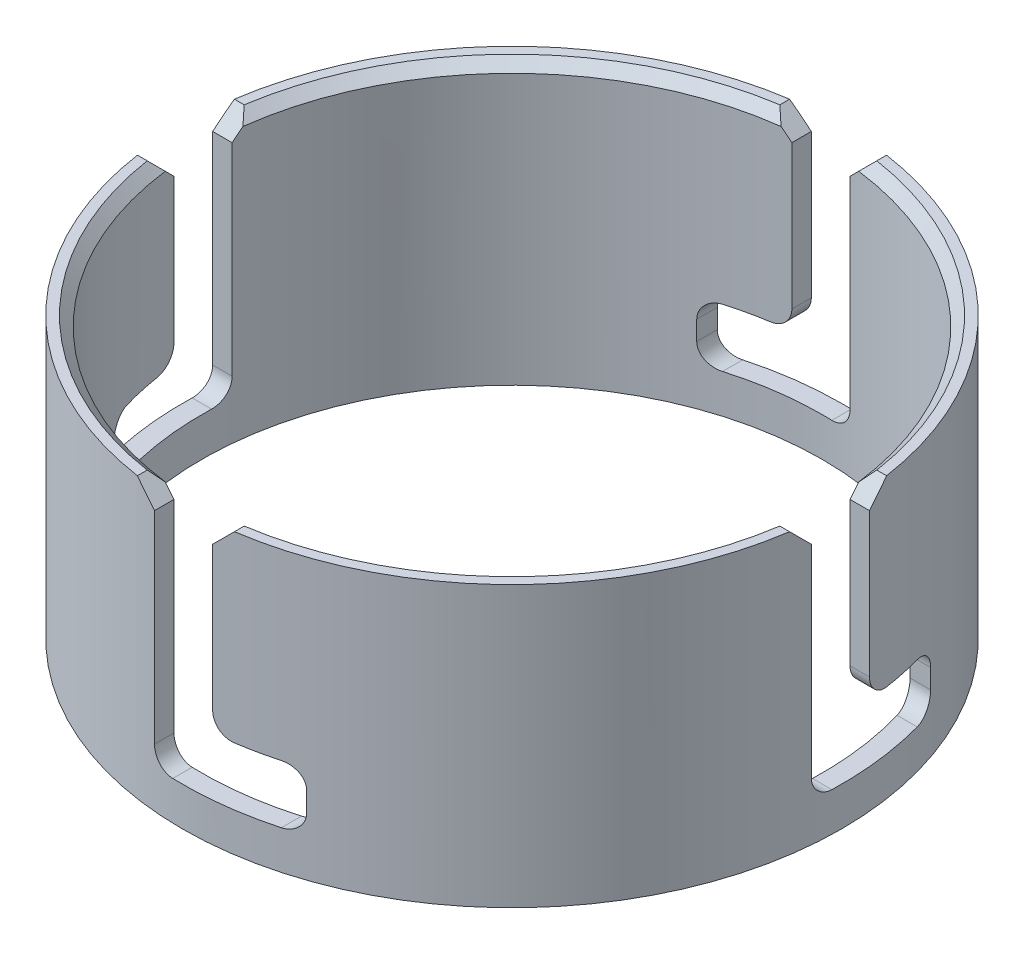
from build123d import *

# Parameters (mm, degrees)
SKETCH2_W                    = 5
SKETCH2_H                    = 72.15
CUT_EXTRUDE1_DEPTH           = 141.198304911
FILLET1_R                    = 5
CHAMFER1_SIZE                = 5
FILLET3_R                    = 5
CIRPATTERN1_COUNT            = 4
FILLET1_OF_CIRPATTERN1_R     = 5
CHAMFER1_OF_CIRPATTERN1_SIZE = 5
FILLET3_OF_CIRPATTERN1_R     = 5
CHAMFER2_SIZE                = 2.5


with BuildPart() as part:
    # Sketch2 → Revolve1 (revolve)
    with BuildSketch(Plane(origin=(0, 0, 0), x_dir=(0, 0, -1), z_dir=(1, 0, 0))):
        with Locations((-82.49983, 36.075)):
            Rectangle(SKETCH2_W, SKETCH2_H)
    revolve(axis=Axis((0, -0.75, 0), (0, 1, 0)))

    # Sketch3 → Cut-Extrude1 (cut, through all)
    with BuildSketch(Plane(origin=(0, 0, 0), x_dir=(0, 0, -1), z_dir=(1, 0, 0))):
        Polygon((-7.5, 72.15), (7.5, 72.15), (7.5, 10), (-27.5, 10), (-27.5, 25), (-7.5, 25), align=None)
    cut_extrude1 = extrude(amount=-CUT_EXTRUDE1_DEPTH, mode=Mode.SUBTRACT)

    # Fillet1
    fillet1_edges = [part.edges().sort_by_distance(p)[0] for p in [
        (-82.157895651, 25, 7.5),
        (-82.157895651, 10, -7.5),
    ]]
    fillet(fillet1_edges, radius=FILLET1_R)

    # Chamfer1
    chamfer1_edges = [part.edges().sort_by_distance(p)[0] for p in [
        (-82.157895651, 72.15, 7.5),
        (-82.157895651, 72.15, -7.5),
    ]]
    chamfer(chamfer1_edges, length=CHAMFER1_SIZE)

    # Fillet3
    fillet3_edges = [part.edges().sort_by_distance(p)[0] for p in [
        (-77.776537511, 25, 27.5),
        (-77.776537511, 10, 27.5),
    ]]
    fillet(fillet3_edges, radius=FILLET3_R)

    # CirPattern1: Cut-Extrude1 ×4 about axis
    cirpattern1_axis = Axis((0, -0.75, 0), (0, 1, 0))
    for i in range(1, CIRPATTERN1_COUNT):
        add(cut_extrude1.rotate(cirpattern1_axis, i * 360 / CIRPATTERN1_COUNT), mode=Mode.SUBTRACT)

    # Fillet1 of CirPattern1
    fillet1_of_cirpattern1_edges = [part.edges().sort_by_distance(p)[0] for p in [
        (7.5, 25, 82.157895651),
        (-7.5, 10, 82.157895651),
        (82.157895651, 25, -7.5),
        (82.157895651, 10, 7.5),
        (-7.5, 25, -82.157895651),
        (7.5, 10, -82.157895651),
    ]]
    fillet(fillet1_of_cirpattern1_edges, radius=FILLET1_OF_CIRPATTERN1_R)

    # Chamfer1 of CirPattern1
    chamfer1_of_cirpattern1_edges = [part.edges().sort_by_distance(p)[0] for p in [
        (7.5, 72.15, 82.157895651),
        (-7.5, 72.15, 82.157895651),
        (82.157895651, 72.15, -7.5),
        (82.157895651, 72.15, 7.5),
        (-7.5, 72.15, -82.157895651),
        (7.5, 72.15, -82.157895651),
    ]]
    chamfer(chamfer1_of_cirpattern1_edges, length=CHAMFER1_OF_CIRPATTERN1_SIZE)

    # Fillet3 of CirPattern1
    fillet3_of_cirpattern1_edges = [part.edges().sort_by_distance(p)[0] for p in [
        (27.5, 25, 77.776537511),
        (27.5, 10, 77.776537511),
        (77.776537511, 25, -27.5),
        (77.776537511, 10, -27.5),
        (-27.5, 25, -77.776537511),
        (-27.5, 10, -77.776537511),
    ]]
    fillet(fillet3_of_cirpattern1_edges, radius=FILLET3_OF_CIRPATTERN1_R)

    # Chamfer2
    chamfer2_edges = [part.edges().sort_by_distance(p)[0] for p in [
        (-56.568422287, 72.15, -56.568422287),
        (56.568422287, 72.15, -56.568422287),
        (56.568422287, 72.15, 56.568422287),
        (-56.568422287, 72.15, 56.568422287),
    ]]
    chamfer(chamfer2_edges, length=CHAMFER2_SIZE)


solid = part.part
